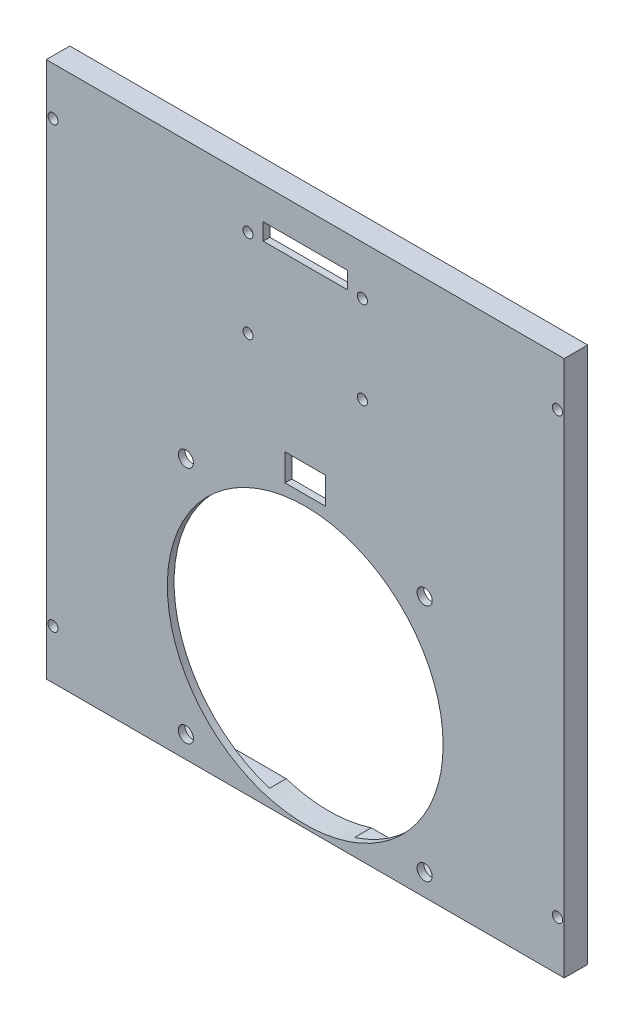
from build123d import *

# Parameters (mm, degrees)
SCHIZZO1_W                   = 154
SCHIZZO1_H                   = 160
SCHIZZO1_R                   = 1.5
ESTRUSIONE_ESTRUSIONE1_DEPTH = 7
SCHIZZO2_R                   = 41
SCHIZZO2_R_2                 = 2.25
SCHIZZO2_W                   = 12
SCHIZZO2_H                   = 8
TAGLIO_ESTRUSIONE1_DEPTH     = 10
SCHIZZO3_R                   = 1.5
SCHIZZO3_W                   = 25
SCHIZZO3_H                   = 5
TAGLIO_ESTRUSIONE2_DEPTH     = 10
SCHIZZO5_W                   = 140
SCHIZZO5_H                   = 154
TAGLIO_ESTRUSIONE3_DEPTH     = 5
SCHIZZO6_R                   = 3
SCHIZZO6_R_2                 = 1.5
ESTRUSIONE_ESTRUSIONE2_DEPTH = 3
RACCORDO1_R                  = 2
SCHIZZO8_W                   = 154
SCHIZZO8_H                   = 7
TAGLIO_ESTRUSIONE4_DEPTH     = 0.5


with BuildPart() as part:
    # Schizzo1 → Estrusione-Estrusione1 (new body)
    with BuildSketch(Plane.XY):
        Rectangle(SCHIZZO1_W, SCHIZZO1_H)
        with Locations((-75, 65.34394728)):
            Circle(SCHIZZO1_R, mode=Mode.SUBTRACT)
        with Locations((75, 65.34394728)):
            Circle(SCHIZZO1_R, mode=Mode.SUBTRACT)
        with Locations((75, -65.34394728)):
            Circle(SCHIZZO1_R, mode=Mode.SUBTRACT)
        with Locations((-75, -65.34394728)):
            Circle(SCHIZZO1_R, mode=Mode.SUBTRACT)
    extrude(amount=ESTRUSIONE_ESTRUSIONE1_DEPTH)

    # Schizzo2 → Taglio-Estrusione1 (cut)
    with BuildSketch(Plane(origin=(0, 0, 0), x_dir=(-1, 0, 0), z_dir=(0, 0, -1))):
        with Locations((0, -38)):
            Circle(SCHIZZO2_R)
        with Locations((35.499999997, -2.500000003)):
            Circle(SCHIZZO2_R_2)
        with Locations((35.499999997, -73.499999997)):
            Circle(SCHIZZO2_R_2)
        with Locations((-35.499999997, -2.500000003)):
            Circle(SCHIZZO2_R_2)
        with Locations((-35.499999997, -73.499999997)):
            Circle(SCHIZZO2_R_2)
        with Locations((0, 10)):
            Rectangle(SCHIZZO2_W, SCHIZZO2_H)
    extrude(amount=-TAGLIO_ESTRUSIONE1_DEPTH, mode=Mode.SUBTRACT)

    # Schizzo3 → Taglio-Estrusione2 (cut)
    with BuildSketch(Plane(origin=(0, 0, 0), x_dir=(-1, 0, 0), z_dir=(0, 0, -1))):
        with Locations((17, 65)):
            Circle(SCHIZZO3_R)
        with Locations((17, 39)):
            Circle(SCHIZZO3_R)
        with Locations((-17, 39)):
            Circle(SCHIZZO3_R)
        with Locations((-17, 65)):
            Circle(SCHIZZO3_R)
        with Locations((0, 67.5)):
            Rectangle(SCHIZZO3_W, SCHIZZO3_H)
    extrude(amount=-TAGLIO_ESTRUSIONE2_DEPTH, mode=Mode.SUBTRACT)

    # Schizzo5 → Taglio-Estrusione3 (cut)
    with BuildSketch(Plane(origin=(0, 0, 0), x_dir=(-1, 0, 0), z_dir=(0, 0, -1))):
        Rectangle(SCHIZZO5_W, SCHIZZO5_H)
    extrude(amount=-TAGLIO_ESTRUSIONE3_DEPTH, mode=Mode.SUBTRACT)

    # Schizzo6 → Estrusione-Estrusione2 (add)
    # profile 1 of 2: a face of its own
    with BuildSketch(Plane(origin=(0, 0, 5), x_dir=(-1, 0, 0), z_dir=(0, 0, -1))):
        with Locations((8, 37)):
            Circle(SCHIZZO6_R)
        with Locations((8, 37)):
            Circle(SCHIZZO6_R_2, mode=Mode.SUBTRACT)
    # profile 2 of 2: a face of its own
    with BuildSketch(Plane(origin=(0, 0, 5), x_dir=(-1, 0, 0), z_dir=(0, 0, -1))):
        with Locations((-8, 37)):
            Circle(SCHIZZO6_R)
        with Locations((-8, 37)):
            Circle(SCHIZZO6_R_2, mode=Mode.SUBTRACT)
    extrude(amount=ESTRUSIONE_ESTRUSIONE2_DEPTH)

    # Raccordo1
    raccordo1_edges = [part.edges().sort_by_distance(p)[0] for p in [
        (11, 37, 5),
        (-5, 37, 5),
    ]]
    fillet(raccordo1_edges, radius=RACCORDO1_R)

    # Schizzo8 → Taglio-Estrusione4 (cut)
    with BuildSketch(Plane(origin=(0, 80, 0), x_dir=(1, 0, 0), z_dir=(0, 1, 0))):
        with Locations((0, -3.5)):
            Rectangle(SCHIZZO8_W, SCHIZZO8_H)
    extrude(amount=-TAGLIO_ESTRUSIONE4_DEPTH, mode=Mode.SUBTRACT)


solid = part.part
